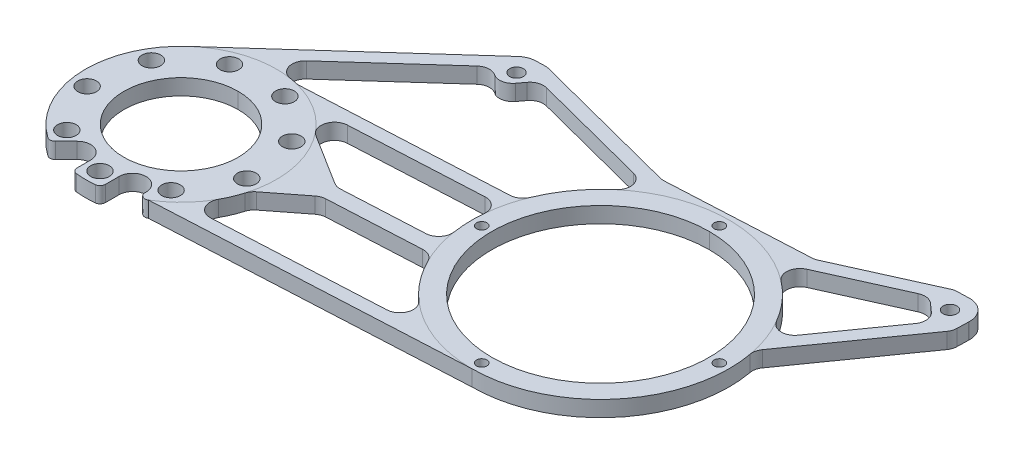
from build123d import *

# Parameters (mm, degrees)
SKETCH3_R           = 2.5
SKETCH3_R_2         = 52.3875
SKETCH3_R_3         = 3.3
SKETCH3_R_4         = 4.5
SKETCH3_R_5         = 27.4955
SKETCH3_R_6         = 3.300000004
BOSS_EXTRUDE1_DEPTH = 7.62
CUT_EXTRUDE3_REACH  = 321.448
CUT_EXTRUDE4_REACH  = 321.448
FILLET1_R           = 6.35
CUT_EXTRUDE10_REACH = 321.448
CUT_EXTRUDE12_REACH = 321.448
CUT_EXTRUDE15_START = -7.62
CUT_EXTRUDE15_DEPTH = 7.62


# Read off the part's stored shape, not the designer's step: Cut-Extrude15
with BuildPart() as part:
    # Sketch3 → Boss-Extrude1 (new body)
    with BuildSketch(Plane(origin=(0, 0, 0), x_dir=(-1, 0, 0), z_dir=(0, 1, 0))):
        with BuildLine():
            Line((-49.427109136, 17.679572239), (34.112309331, 92.818281558))
            ThreePointArc((34.112309331, 92.818281558), (49.260131818, 129.740728466), (29.825562347, 164.597881552))
            ThreePointArc((29.825562347, 164.597881552), (28.145398332, 165.051242365), (26.567761736, 164.316701751))
            Line((26.567761736, 164.316701751), (21.302878118, 159.051818133))
            ThreePointArc((21.302878118, 159.051818133), (14.21924173, 157.642795249), (10.20668404, 163.648012211))
            Line((10.20668404, 163.648012211), (10.20668404, 170.220745001))
            ThreePointArc((10.20668404, 170.220745001), (9.549518747, 171.925600851), (7.91807501, 172.748273949))
            ThreePointArc((7.91807501, 172.748273949), (3.367898451, 172.974), (-1.182278109, 172.748273949))
            ThreePointArc((-1.182278109, 172.748273949), (-2.813721846, 171.925600851), (-3.470887139, 170.220745001))
            Line((-3.470887139, 170.220745001), (-3.470887139, 163.648012211))
            ThreePointArc((-3.470887139, 163.648012211), (-9.970887139, 157.148012211), (-16.470887139, 163.648012211))
            Line((-16.470887139, 163.648012211), (-16.470887139, 164.225022653))
            ThreePointArc((-16.470887139, 164.225022653), (-17.760387302, 166.435870942), (-20.319588051, 166.401924563))
            Line((-20.319588051, 166.401924563), (-168.403592651, 158.863977372))
            Line((-168.403592651, 158.863977372), (-265.178957518, 163.648012211))
            Line((-265.178957518, 163.648012211), (-268.446360693, 19.778758396))
            ThreePointArc((-268.446360693, 19.778758396), (-265.639755471, 12.584633122), (-258.423714062, 9.834866275))
            Line((-258.423714062, 9.834866275), (-55.796807523, 15.236419982))
            ThreePointArc((-55.796807523, 15.236419982), (-52.385720802, 15.868157792), (-49.427109136, 17.679572239))
        make_face()
        with Locations(Location((-168.403592651, 39.801477371, 0), (0, 0, 90))):
            Circle(SKETCH3_R, mode=Mode.SUBTRACT)
        with Locations(Location((-225.553592651, 96.951477371, 0), (0, 0, 90))):
            Circle(SKETCH3_R, mode=Mode.SUBTRACT)
        with Locations(Location((-168.403592651, 96.951477372, 0), (0, 0, 90))):
            Circle(SKETCH3_R_2, mode=Mode.SUBTRACT)
        with Locations(Location((-111.253592651, 96.951477371, 0), (0, 0, 90))):
            Circle(SKETCH3_R, mode=Mode.SUBTRACT)
        with Locations(Location((-168.403592651, 154.101477371, 0), (0, 0, 90))):
            Circle(SKETCH3_R, mode=Mode.SUBTRACT)
        with Locations(Location((-55.796807523, 24.761419982, 0), (0, 0, 90))):
            Circle(SKETCH3_R_3, mode=Mode.SUBTRACT)
        with Locations(Location((28.436615228, 156.875733282, 0), (0, 0, 90))):
            Circle(SKETCH3_R_4, mode=Mode.SUBTRACT)
        with Locations(Location((-9.970887139, 90.351987789, 0), (0, 0, 90))):
            Circle(SKETCH3_R_4, mode=Mode.SUBTRACT)
        with Locations(Location((16.70668404, 90.351987789, 0), (0, 0, 90))):
            Circle(SKETCH3_R_4, mode=Mode.SUBTRACT)
        with Locations(Location((-30.407092297, 107.5, 0), (0, 0, 90))):
            Circle(SKETCH3_R_4, mode=Mode.SUBTRACT)
        with Locations(Location((37.142889198, 107.5, 0), (0, 0, 90))):
            Circle(SKETCH3_R_4, mode=Mode.SUBTRACT)
        with Locations(Location((3.367898451, 127, 0), (0, 0, 90))):
            Circle(SKETCH3_R_5, mode=Mode.SUBTRACT)
        with Locations(Location((-35.039603917, 133.772278929, 0), (0, 0, 90))):
            Circle(SKETCH3_R_4, mode=Mode.SUBTRACT)
        with Locations(Location((41.775400818, 133.772278929, 0), (0, 0, 90))):
            Circle(SKETCH3_R_4, mode=Mode.SUBTRACT)
        with Locations(Location((-21.700818327, 156.875733282, 0), (0, 0, 90))):
            Circle(SKETCH3_R_4, mode=Mode.SUBTRACT)
        with Locations(Location((3.367898451, 166, 0), (0, 0, 90))):
            Circle(SKETCH3_R_4, mode=Mode.SUBTRACT)
        with Locations(Location((-258.931181349, 19.346338398, 0), (0, 0, 90))):
            Circle(SKETCH3_R_6, mode=Mode.SUBTRACT)
    extrude(amount=BOSS_EXTRUDE1_DEPTH)

    # Sketch12 → Cut-Extrude3 (cut, up to next)
    with BuildSketch(Plane(origin=(0, 7.62, 0), x_dir=(1, 0, 0), z_dir=(0, 1, 0)), mode=Mode.PRIVATE) as cut_extrude3_sk1:
        with BuildLine():
            Line((265.178957518, -163.648012211), (267.97556459, -40.508702148))
            Line((267.97556459, -40.508702148), (230.316092651, -96.951477372))
            ThreePointArc((230.316092651, -96.951477372), (212.182341242, -140.730225962), (168.403592651, -158.863977372))
            Line((168.403592651, -158.863977372), (265.178957518, -163.648012211))
        make_face()
    cut_extrude3_tool1 = extrude(cut_extrude3_sk1.sketch, amount=-CUT_EXTRUDE3_REACH, mode=Mode.PRIVATE) & part.part
    # Sketch12 → Cut-Extrude3 (cut, up to next)
    with BuildSketch(Plane(origin=(0, 7.62, 0), x_dir=(1, 0, 0), z_dir=(0, 1, 0)), mode=Mode.PRIVATE) as cut_extrude3_sk2:
        with BuildLine():
            Line((267.97556459, -40.508702148), (268.273601144, -27.385651725))
            Line((268.273601144, -27.385651725), (228.792351717, -83.300271022))
            ThreePointArc((228.792351717, -83.300271022), (229.933978242, -90.083486013), (230.316092651, -96.951477372))
            Line((230.316092651, -96.951477372), (267.97556459, -40.508702148))
        make_face()
    cut_extrude3_tool2 = extrude(cut_extrude3_sk2.sketch, amount=-CUT_EXTRUDE3_REACH, mode=Mode.PRIVATE) & part.part
    add(cut_extrude3_tool1.solids().sort_by_distance((242.898488, 7.62, 120.934583))[0], mode=Mode.SUBTRACT)
    add(cut_extrude3_tool2.solids().sort_by_distance((248.238841, 7.62, 62.857625))[0], mode=Mode.SUBTRACT)

    # Sketch13 → Cut-Extrude4 (cut, up to next)
    with BuildSketch(Plane(origin=(0, 7.62, 0), x_dir=(1, 0, 0), z_dir=(0, 1, 0)), mode=Mode.PRIVATE) as cut_extrude4_sk1:
        Polygon((205.359295361, -30.862514021), (251.718937312, -10.013599753), (60.814888047, -15.102649833), (135.412495886, -34.423028757), align=None)
    cut_extrude4_tool1 = extrude(cut_extrude4_sk1.sketch, amount=-CUT_EXTRUDE4_REACH, mode=Mode.PRIVATE) & part.part
    add(cut_extrude4_tool1.solids().sort_by_distance((160.937928, 7.62, 21.113641))[0], mode=Mode.SUBTRACT)

    # Fillet1
    fillet1_edges = [part.edges().sort_by_distance(p)[0] for p in [
        (268.273601144, 3.81, 27.385651725),
        (228.792351717, 3.81, 83.300271022),
        (205.359295361, 3.81, 30.862514021),
        (135.412495886, 3.81, 34.423028757),
        (60.814888047, 3.81, 15.102649833),
        (251.718937312, 3.81, 10.013599753),
        (258.423714062, 3.81, 9.834866275),
        (268.446360693, 3.81, 19.778758396),
    ]]
    fillet(fillet1_edges, radius=FILLET1_R)

    # Sketch14 → Cut-Extrude10 (cut, up to next)
    with BuildSketch(Plane(origin=(0, 7.62, 0), x_dir=(1, 0, 0), z_dir=(0, 1, 0)), mode=Mode.PRIVATE) as cut_extrude10_sk1:
        with BuildLine():
            Line((244.52170499, -20.212940115), (207.524518121, -36.851359757))
            ThreePointArc((207.524518121, -36.851359757), (203.733724344, -42.021157152), (206.219824449, -47.930152738))
            ThreePointArc((206.219824449, -47.930152738), (214.983198468, -56.165475138), (221.98921849, -65.939570631))
            ThreePointArc((221.98921849, -65.939570631), (227.324020713, -69.178317741), (232.928793139, -66.433117629))
            Line((232.928793139, -66.433117629), (256.310542684, -33.319129513))
            ThreePointArc((256.310542684, -33.319129513), (257.474332837, -28.977686692), (255.544041259, -24.91856022))
            Line((255.544041259, -24.91856022), (251.895986311, -21.657423526))
            ThreePointArc((251.895986311, -21.657423526), (248.438629388, -19.762105057), (244.52170499, -20.212940115))
        make_face()
    cut_extrude10_tool1 = extrude(cut_extrude10_sk1.sketch, amount=-CUT_EXTRUDE10_REACH, mode=Mode.PRIVATE) & part.part
    add(cut_extrude10_tool1.solids().sort_by_distance((231.191654, 7.62, 42.620708))[0], mode=Mode.SUBTRACT)

    # Sketch19 → Cut-Extrude12 (cut, up to next)
    with BuildSketch(Plane(origin=(0, 7.62, 0), x_dir=(1, 0, 0), z_dir=(0, 1, 0)), mode=Mode.PRIVATE) as cut_extrude12_sk1:
        with BuildLine():
            Line((69.235394101, -23.843032422), (125.774906007, -38.486461693))
            ThreePointArc((125.774906007, -38.486461693), (130.483030138, -43.330085475), (128.351144664, -49.739624343))
            ThreePointArc((128.351144664, -49.739624343), (118.321232933, -60.552096865), (111.133194535, -73.43001577))
            ThreePointArc((111.133194535, -73.43001577), (108.875130187, -76.266983385), (105.448899127, -77.453651229))
            Line((105.448899127, -77.453651229), (8.811557915, -82.372799497))
            ThreePointArc((8.811557915, -82.372799497), (7.906607304, -82.355788757), (7.012785778, -82.213282427))
            ThreePointArc((7.012785778, -82.213282427), (5.382114006, -81.866354479), (3.739935744, -81.578778428))
            ThreePointArc((3.739935744, -81.578778428), (-1.488167541, -77.00545388), (0.396861915, -70.320020062))
            Line((0.396861915, -70.320020062), (43.530504975, -31.52388852))
            ThreePointArc((43.530504975, -31.52388852), (47.329210716, -29.879304731), (51.350676973, -30.860441973))
            Line((51.350676973, -30.860441973), (52.480075426, -31.573618446))
            ThreePointArc((52.480075426, -31.573618446), (56.613803862, -31.757331678), (60.021401634, -29.410048407))
            Line((60.021401634, -29.410048407), (62.404331593, -26.234763269))
            ThreePointArc((62.404331593, -26.234763269), (65.456340654, -24.000636026), (69.235394101, -23.843032422))
        make_face()
    cut_extrude12_tool1 = extrude(cut_extrude12_sk1.sketch, amount=-CUT_EXTRUDE12_REACH, mode=Mode.PRIVATE) & part.part
    add(cut_extrude12_tool1.solids().sort_by_distance((66.631089, 7.62, 56.211545))[0], mode=Mode.SUBTRACT)

    # Cut-Extrude15 outline → Cut-Extrude15 (cut)
    with BuildSketch(Plane(origin=(0, 7.62, 0), x_dir=(1, 0, 0), z_dir=(0, 1, 0)).offset(CUT_EXTRUDE15_START)):
        with BuildLine():
            ThreePointArc((40.660849974, -140.231703904), (39.001844492, -144.844146352), (36.861191377, -149.253741431))
            ThreePointArc((36.861191377, -149.253741431), (37.035613438, -155.845233628), (42.881616461, -158.895223973))
            Line((42.881616461, -158.895223973), (123.520323562, -154.790457105))
            ThreePointArc((123.520323562, -154.790457105), (129.329486204, -150.437715141), (127.48704531, -143.416451383))
            ThreePointArc((127.48704531, -143.416451383), (119.32579193, -134.694385747), (112.991346909, -124.567427074))
            ThreePointArc((112.991346909, -124.567427074), (110.452063443, -121.853539717), (106.841075413, -120.973817853))
            Line((106.841075413, -120.973817853), (62.446585261, -123.233638711))
            ThreePointArc((62.446585261, -123.233638711), (60.509103742, -123.633603237), (58.781566428, -124.597668114))
            Line((58.781566428, -124.597668114), (42.892536771, -136.97318668))
            ThreePointArc((42.892536771, -136.97318668), (41.523311936, -138.428909918), (40.660849974, -140.231703904))
        make_face()
        with BuildLine():
            ThreePointArc((32.229200226, -97.90609614), (32.230013577, -97.907091323), (32.2308269, -97.908086529))
            ThreePointArc((32.2308269, -97.908086529), (32.963651262, -98.668536238), (33.809910067, -99.300328325))
            Line((33.809910067, -99.300328325), (58.274621766, -114.638670821))
            ThreePointArc((58.274621766, -114.638670821), (60.09112394, -115.422332807), (62.059204559, -115.623491788))
            Line((62.059204559, -115.623491788), (101.082626056, -113.637075421))
            ThreePointArc((101.082626056, -113.637075421), (105.786794259, -111.258015784), (107.181907879, -106.174436215))
            ThreePointArc((107.181907879, -106.174436215), (106.515656468, -98.695326918), (106.759699387, -91.190567769))
            ThreePointArc((106.759699387, -91.190567769), (104.979666567, -86.085957931), (99.954945116, -84.091532504))
            Line((99.954945116, -84.091532504), (36.935219874, -87.299437113))
            ThreePointArc((36.935219874, -87.299437113), (31.322143272, -91.156322431), (32.229200226, -97.90609614))
        make_face()
    extrude(amount=CUT_EXTRUDE15_DEPTH, mode=Mode.SUBTRACT)


solid = part.part
